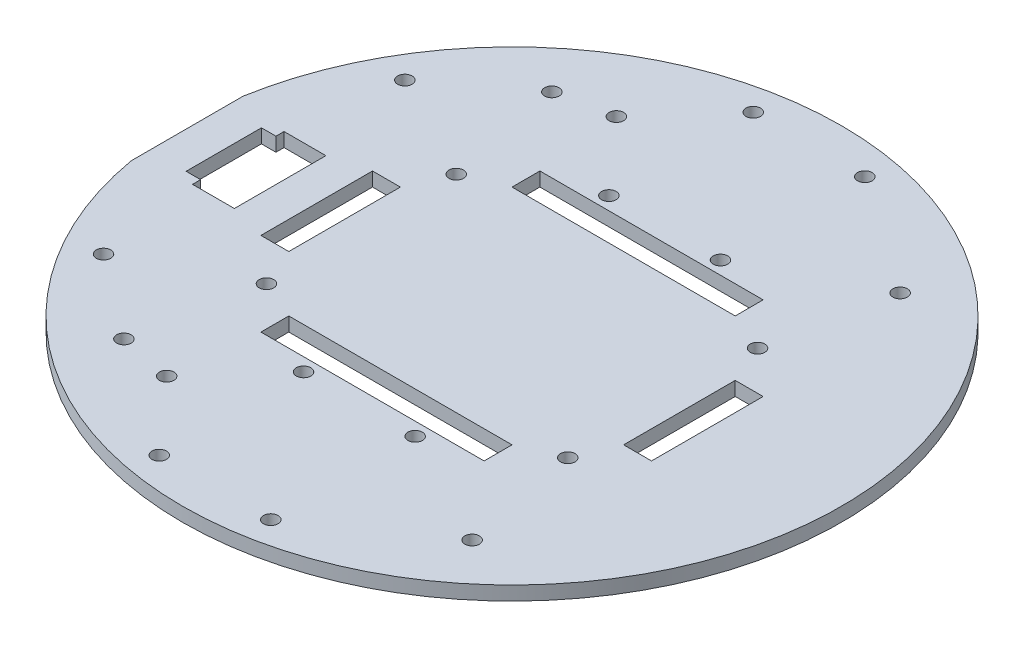
from build123d import *

# Parameters (mm, degrees)
SKETCH1_R           = 1.651
SKETCH1_W           = 50.8
SKETCH1_H           = 6.35
SKETCH1_W_2         = 6.35
SKETCH1_H_2         = 25.4
BOSS_EXTRUDE1_DEPTH = 3.175


with BuildPart() as part:
    # Sketch1 → Boss-Extrude1 (new body)
    with BuildSketch(Plane(origin=(0, 0, 0), x_dir=(1, 0, 0), z_dir=(0, 1, 0))):
        with BuildLine():
            Line((-73.916912814, 12.7), (-73.916912814, -12.7))
            ThreePointArc((-73.916912814, -12.7), (75, 0), (-73.916912814, 12.7))
        make_face()
        with Locations((-34.29, 21.59)):
            Circle(SKETCH1_R, mode=Mode.SUBTRACT)
        with Locations((34.29, 21.59)):
            Circle(SKETCH1_R, mode=Mode.SUBTRACT)
        with Locations((-34.29, -21.59)):
            Circle(SKETCH1_R, mode=Mode.SUBTRACT)
        with Locations((34.29, -21.59)):
            Circle(SKETCH1_R, mode=Mode.SUBTRACT)
        with Locations((39.626912814, -48.698461806)):
            Circle(SKETCH1_R, mode=Mode.SUBTRACT)
        with Locations((-39.626912814, -48.698461806)):
            Circle(SKETCH1_R, mode=Mode.SUBTRACT)
        with Locations((-58.676912814, -34.29)):
            Circle(SKETCH1_R, mode=Mode.SUBTRACT)
        with Locations((-58.676912814, 34.29)):
            Circle(SKETCH1_R, mode=Mode.SUBTRACT)
        with Locations((-39.626912814, 48.698461806)):
            Circle(SKETCH1_R, mode=Mode.SUBTRACT)
        with Locations((39.626912814, 48.698461806)):
            Circle(SKETCH1_R, mode=Mode.SUBTRACT)
        with Locations((12.7, -67.593386492)):
            Circle(SKETCH1_R, mode=Mode.SUBTRACT)
        with Locations((12.7, -34.743386492)):
            Circle(SKETCH1_R, mode=Mode.SUBTRACT)
        with Locations((12.7, 34.743386492)):
            Circle(SKETCH1_R, mode=Mode.SUBTRACT)
        with Locations((12.7, 67.593386492)):
            Circle(SKETCH1_R, mode=Mode.SUBTRACT)
        with Locations((-27.425, -51.168386492)):
            Circle(SKETCH1_R, mode=Mode.SUBTRACT)
        with Locations((-12.7, -34.743386492)):
            Circle(SKETCH1_R, mode=Mode.SUBTRACT)
        with Locations((-12.7, -67.593386492)):
            Circle(SKETCH1_R, mode=Mode.SUBTRACT)
        with Locations((-12.7, 67.593386492)):
            Circle(SKETCH1_R, mode=Mode.SUBTRACT)
        with Locations((-27.425, 51.168386492)):
            Circle(SKETCH1_R, mode=Mode.SUBTRACT)
        with Locations((-12.7, 34.743386492)):
            Circle(SKETCH1_R, mode=Mode.SUBTRACT)
        with Locations((0, 28.575)):
            Rectangle(SKETCH1_W, SKETCH1_H, mode=Mode.SUBTRACT)
        with Locations((41.275, 0)):
            Rectangle(SKETCH1_W_2, SKETCH1_H_2, mode=Mode.SUBTRACT)
        with Locations((0, -28.575)):
            Rectangle(SKETCH1_W, SKETCH1_H, mode=Mode.SUBTRACT)
        with Locations((-41.275, 0)):
            Rectangle(SKETCH1_W_2, SKETCH1_H_2, mode=Mode.SUBTRACT)
        Polygon((-65.596956407, 8.5725), (-62.294956407, 8.5725), (-62.294956407, 10.414), (-52.769956407, 10.414), (-52.769956407, 8.5725), (-52.769956407, -8.5725), (-52.769956407, -10.414), (-62.294956407, -10.414), (-62.294956407, -8.5725), (-65.596956407, -8.5725), align=None, mode=Mode.SUBTRACT)
    extrude(amount=BOSS_EXTRUDE1_DEPTH)


solid = part.part
